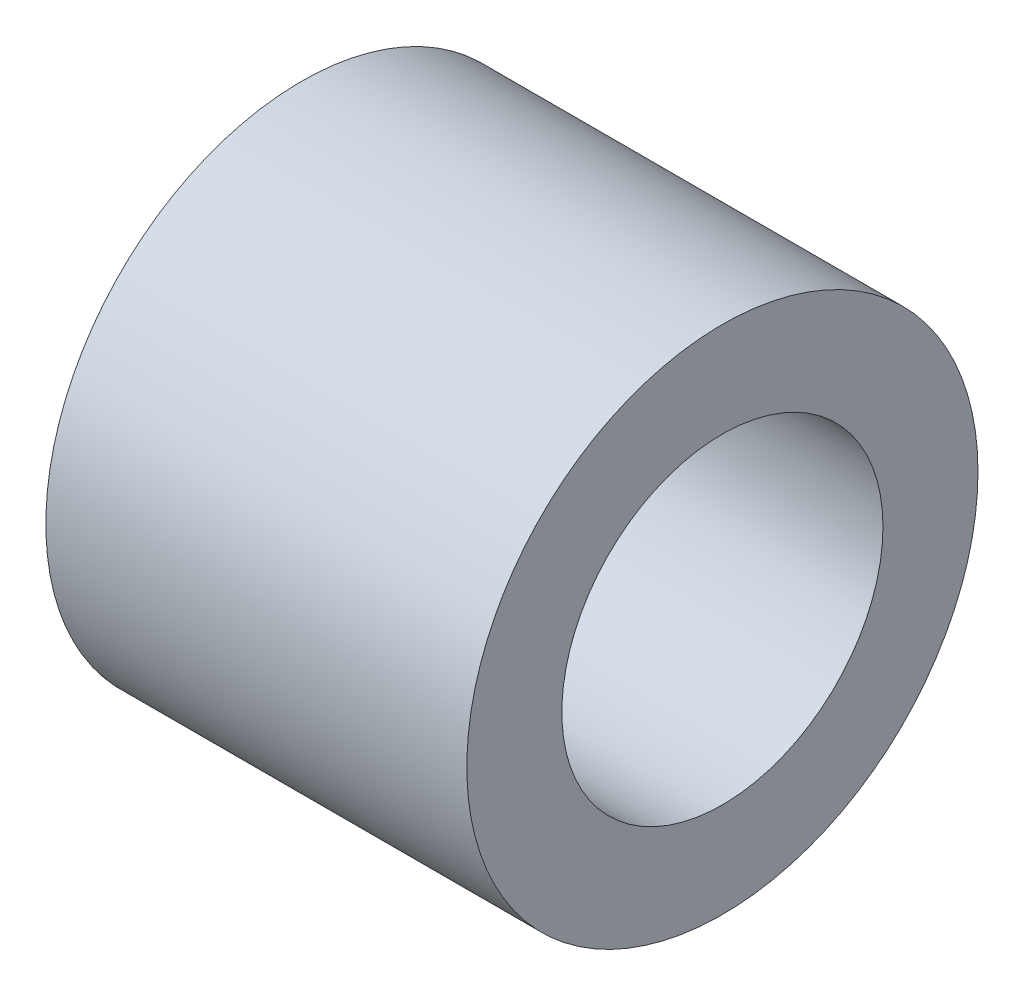
from build123d import *

# Parameters (mm, degrees)
SKETCH1_R           = 5.3975
SKETCH1_R_2         = 3.3909
BOSS_EXTRUDE1_DEPTH = 8.89


with BuildPart() as part:
    # Sketch1 → Boss-Extrude1 (new body)
    with BuildSketch(Plane(origin=(0, 0, 0), x_dir=(0, 0, -1), z_dir=(1, 0, 0))):
        Circle(SKETCH1_R)
        Circle(SKETCH1_R_2, mode=Mode.SUBTRACT)
    extrude(amount=BOSS_EXTRUDE1_DEPTH)


solid = part.part
